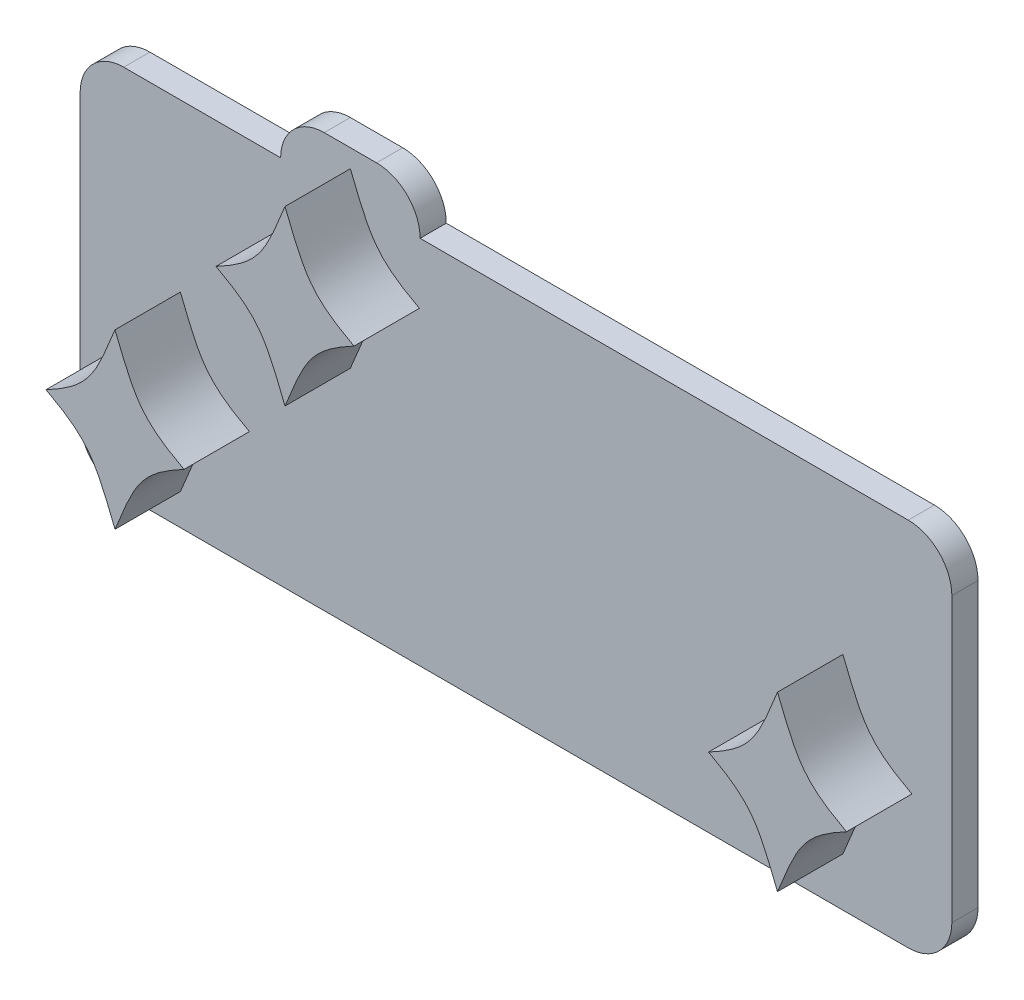
from build123d import *

# Parameters (mm, degrees)
BOSS_EXTRUDE1_DEPTH = 0.6
BOSS_EXTRUDE2_DEPTH = 1.5
FILLET1_R           = 1


with BuildPart() as part:
    # Sketch2 → Boss-Extrude1 (new body)
    with BuildSketch(Plane.XY):
        Polygon((-9, 11), (-4.4, 11), (-4.4, 12), (-1.2, 12), (-1.2, 11), (11, 11), (11, 2.5), (-9, 2.5), align=None)
    extrude(amount=-BOSS_EXTRUDE1_DEPTH)

    # Sketch1 → Boss-Extrude2 (add)
    with BuildSketch(Plane.XY):
        with BuildLine():
            add(Edge.make_bspline(
                [(8.5, 7.582250387), (8.448081693, 7.453099482), (8.337951661, 7.179459039), (8.156392198, 6.75959463), (7.928053742, 6.343866223), (7.606398256, 6.024741111), (7.260761425, 5.790247234), (7.028066866, 5.65925749), (6.916719247, 5.6)],
                knots=[0.057904746, 0.057904746, 0.057904746, 0.057904746, 0.169421818, 0.28093889, 0.503973033, 0.727007177, 0.838524249, 0.95004132, 0.95004132, 0.95004132, 0.95004132], degree=3))
            add(Edge.make_bspline(
                [(6.916719247, 5.6), (7.028066866, 5.54074251), (7.260761425, 5.409752766), (7.606398256, 5.175258889), (7.928053742, 4.856133777), (8.156392198, 4.44040537), (8.337951661, 4.020540961), (8.448081693, 3.746900518), (8.5, 3.617749613)],
                knots=[0.057904746, 0.057904746, 0.057904746, 0.057904746, 0.169421818, 0.28093889, 0.503973033, 0.727007177, 0.838524249, 0.95004132, 0.95004132, 0.95004132, 0.95004132], degree=3))
            add(Edge.make_bspline(
                [(8.5, 3.617749613), (8.551918307, 3.746900518), (8.662048339, 4.020540961), (8.843607802, 4.44040537), (9.071946258, 4.856133777), (9.393601744, 5.175258889), (9.739238575, 5.409752766), (9.971933134, 5.54074251), (10.083280753, 5.6)],
                knots=[0.057904746, 0.057904746, 0.057904746, 0.057904746, 0.169421818, 0.28093889, 0.503973033, 0.727007177, 0.838524249, 0.95004132, 0.95004132, 0.95004132, 0.95004132], degree=3))
            add(Edge.make_bspline(
                [(10.083280753, 5.6), (9.971933134, 5.65925749), (9.739238575, 5.790247234), (9.393601744, 6.024741111), (9.071946258, 6.343866223), (8.843607802, 6.75959463), (8.662048339, 7.179459039), (8.551918307, 7.453099482), (8.5, 7.582250387)],
                knots=[0.057904746, 0.057904746, 0.057904746, 0.057904746, 0.169421818, 0.28093889, 0.503973033, 0.727007177, 0.838524249, 0.95004132, 0.95004132, 0.95004132, 0.95004132], degree=3))
        make_face()
        with BuildLine():
            add(Edge.make_bspline(
                [(-2.8, 7.617749613), (-2.748081693, 7.746900518), (-2.637951661, 8.020540961), (-2.456392198, 8.44040537), (-2.228053742, 8.856133777), (-1.906398256, 9.175258889), (-1.560761425, 9.409752766), (-1.328066866, 9.54074251), (-1.216719247, 9.6)],
                knots=[0.057904746, 0.057904746, 0.057904746, 0.057904746, 0.169421818, 0.28093889, 0.503973033, 0.727007177, 0.838524249, 0.95004132, 0.95004132, 0.95004132, 0.95004132], degree=3))
            add(Edge.make_bspline(
                [(-1.216719247, 9.6), (-1.328066866, 9.65925749), (-1.560761425, 9.790247234), (-1.906398256, 10.024741111), (-2.228053742, 10.343866223), (-2.456392198, 10.75959463), (-2.637951661, 11.179459039), (-2.748081693, 11.453099482), (-2.8, 11.582250387)],
                knots=[0.057904746, 0.057904746, 0.057904746, 0.057904746, 0.169421818, 0.28093889, 0.503973033, 0.727007177, 0.838524249, 0.95004132, 0.95004132, 0.95004132, 0.95004132], degree=3))
            add(Edge.make_bspline(
                [(-2.8, 11.582250387), (-2.851918307, 11.453099482), (-2.962048339, 11.179459039), (-3.143607802, 10.75959463), (-3.371946258, 10.343866223), (-3.693601744, 10.024741111), (-4.039238575, 9.790247234), (-4.271933134, 9.65925749), (-4.383280753, 9.6)],
                knots=[0.057904746, 0.057904746, 0.057904746, 0.057904746, 0.169421818, 0.28093889, 0.503973033, 0.727007177, 0.838524249, 0.95004132, 0.95004132, 0.95004132, 0.95004132], degree=3))
            add(Edge.make_bspline(
                [(-4.383280753, 9.6), (-4.271933134, 9.54074251), (-4.039238575, 9.409752766), (-3.693601744, 9.175258889), (-3.371946258, 8.856133777), (-3.143607802, 8.44040537), (-2.962048339, 8.020540961), (-2.851918307, 7.746900518), (-2.8, 7.617749613)],
                knots=[0.057904746, 0.057904746, 0.057904746, 0.057904746, 0.169421818, 0.28093889, 0.503973033, 0.727007177, 0.838524249, 0.95004132, 0.95004132, 0.95004132, 0.95004132], degree=3))
        make_face()
        with BuildLine():
            add(Edge.make_bspline(
                [(-6.7, 7.182250387), (-6.751918307, 7.053099482), (-6.862048339, 6.779459039), (-7.043607802, 6.35959463), (-7.271946258, 5.943866223), (-7.593601744, 5.624741111), (-7.939238575, 5.390247234), (-8.171933134, 5.25925749), (-8.283280753, 5.2)],
                knots=[0.057904746, 0.057904746, 0.057904746, 0.057904746, 0.169421818, 0.28093889, 0.503973033, 0.727007177, 0.838524249, 0.95004132, 0.95004132, 0.95004132, 0.95004132], degree=3))
            add(Edge.make_bspline(
                [(-8.283280753, 5.2), (-8.171933134, 5.14074251), (-7.939238575, 5.009752766), (-7.593601744, 4.775258889), (-7.271946258, 4.456133777), (-7.043607802, 4.04040537), (-6.862048339, 3.620540961), (-6.751918307, 3.346900518), (-6.7, 3.217749613)],
                knots=[0.057904746, 0.057904746, 0.057904746, 0.057904746, 0.169421818, 0.28093889, 0.503973033, 0.727007177, 0.838524249, 0.95004132, 0.95004132, 0.95004132, 0.95004132], degree=3))
            add(Edge.make_bspline(
                [(-6.7, 3.217749613), (-6.648081693, 3.346900518), (-6.537951661, 3.620540961), (-6.356392198, 4.04040537), (-6.128053742, 4.456133777), (-5.806398256, 4.775258889), (-5.460761425, 5.009752766), (-5.228066866, 5.14074251), (-5.116719247, 5.2)],
                knots=[0.057904746, 0.057904746, 0.057904746, 0.057904746, 0.169421818, 0.28093889, 0.503973033, 0.727007177, 0.838524249, 0.95004132, 0.95004132, 0.95004132, 0.95004132], degree=3))
            add(Edge.make_bspline(
                [(-5.116719247, 5.2), (-5.228066866, 5.25925749), (-5.460761425, 5.390247234), (-5.806398256, 5.624741111), (-6.128053742, 5.943866223), (-6.356392198, 6.35959463), (-6.537951661, 6.779459039), (-6.648081693, 7.053099482), (-6.7, 7.182250387)],
                knots=[0.057904746, 0.057904746, 0.057904746, 0.057904746, 0.169421818, 0.28093889, 0.503973033, 0.727007177, 0.838524249, 0.95004132, 0.95004132, 0.95004132, 0.95004132], degree=3))
        make_face()
    extrude(amount=BOSS_EXTRUDE2_DEPTH)

    # Fillet1
    fillet1_edges = [part.edges().sort_by_distance(p)[0] for p in [
        (-9, 2.5, -0.3),
        (11, 2.5, -0.3),
        (11, 11, -0.3),
        (-1.2, 12, -0.3),
        (-4.4, 12, -0.3),
        (-9, 11, -0.3),
    ]]
    fillet(fillet1_edges, radius=FILLET1_R - 0.0001)  # a hair under: the kernel refuses the full size


solid = part.part
